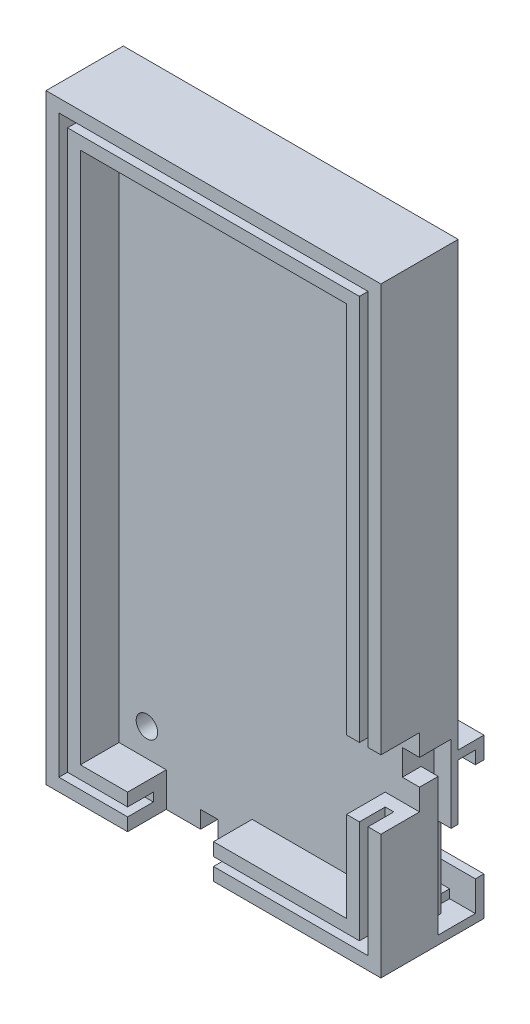
from build123d import *

# Parameters (mm, degrees)
SKETCH1_W           = 39
SKETCH1_H           = 70
BOSS_EXTRUDE1_DEPTH = 4.5
SKETCH2_W           = 39
SKETCH2_H           = 70
SKETCH2_W_2         = 31
SKETCH2_H_2         = 62
BOSS_EXTRUDE2_DEPTH = 4.5
SKETCH3_W           = 10
SKETCH3_H           = 4.5
CUT_EXTRUDE1_DEPTH  = 4
SKETCH4_W           = 4.5
SKETCH4_H           = 8
CUT_EXTRUDE2_DEPTH  = 4
SKETCH5_R           = 1.25
CUT_EXTRUDE3_DEPTH  = 4
BOSS_EXTRUDE3_DEPTH = 3
SKETCH8_W           = 1
SKETCH8_H           = 1
BOSS_EXTRUDE4_DEPTH = 28
SKETCH9_W           = 1
SKETCH9_H           = 16.5
BOSS_EXTRUDE5_DEPTH = 14
SKETCH10_W          = 1
SKETCH10_H          = 1.5
SKETCH10_H_2        = 3.5
BOSS_EXTRUDE6_DEPTH = 17
SKETCH11_W          = 1
SKETCH11_H          = 3
BOSS_EXTRUDE7_DEPTH = 3
CUT_EXTRUDE4_DEPTH  = 2
CUT_EXTRUDE5_DEPTH  = 2
SKETCH14_W          = 36
SKETCH14_H          = 67
SKETCH14_W_2        = 34
SKETCH14_H_2        = 65
CUT_EXTRUDE6_DEPTH  = 3


with BuildPart() as part:
    # Sketch1 → Boss-Extrude1 (new body)
    with BuildSketch(Plane.XY):
        with Locations((19.5, 35)):
            Rectangle(SKETCH1_W, SKETCH1_H)
    extrude(amount=BOSS_EXTRUDE1_DEPTH)

    # Sketch2 → Boss-Extrude2 (add)
    with BuildSketch(Plane.XY.offset(4.5)):
        with Locations((19.5, 35)):
            Rectangle(SKETCH2_W, SKETCH2_H)
        with Locations((19.5, 35)):
            Rectangle(SKETCH2_W_2, SKETCH2_H_2, mode=Mode.SUBTRACT)
    extrude(amount=BOSS_EXTRUDE2_DEPTH)

    # Sketch3 → Cut-Extrude1 (cut)
    with BuildSketch(Plane(origin=(0, 4, 0), x_dir=(1, 0, 0), z_dir=(0, 1, 0))):
        with Locations((14.5, -6.75)):
            Rectangle(SKETCH3_W, SKETCH3_H)
    extrude(amount=-CUT_EXTRUDE1_DEPTH, mode=Mode.SUBTRACT)

    # Sketch4 → Cut-Extrude2 (cut)
    with BuildSketch(Plane.ZY.offset(-35)):
        with Locations((6.75, 18.5)):
            Rectangle(SKETCH4_W, SKETCH4_H)
    extrude(amount=-CUT_EXTRUDE2_DEPTH, mode=Mode.SUBTRACT)

    # Sketch5 → Cut-Extrude3 (cut)
    with BuildSketch(Plane.XY.offset(4.5)):
        with Locations((7.25, 7.25)):
            Circle(SKETCH5_R)
        with Locations((31.75, 7.25)):
            Circle(SKETCH5_R)
        with Locations((7.25, 62.75)):
            Circle(SKETCH5_R)
    extrude(amount=-CUT_EXTRUDE3_DEPTH, mode=Mode.SUBTRACT)

    # Sketch7 → Boss-Extrude3 (add)
    with BuildSketch(Plane(origin=(0, 0, 0), x_dir=(-1, 0, 0), z_dir=(0, 0, -1))):
        Polygon((-8, 1), (-39, 1), (-39, 0), (-7, 0), (-7, 18.5), (-39, 18.5), (-39, 17.5), (-8, 17.5), align=None)
    extrude(amount=BOSS_EXTRUDE3_DEPTH)

    # Sketch8 → Boss-Extrude4 (add)
    with BuildSketch(Plane(origin=(8, 0, 0), x_dir=(0, 0, -1), z_dir=(1, 0, 0))):
        with Locations((1.5, 17)):
            Rectangle(SKETCH8_W, SKETCH8_H)
        with Locations((1.5, 1.5)):
            Rectangle(SKETCH8_W, SKETCH8_H)
    extrude(amount=BOSS_EXTRUDE4_DEPTH)

    # Sketch9 → Boss-Extrude5 (add)
    with BuildSketch(Plane(origin=(8, 0, 0), x_dir=(0, 0, -1), z_dir=(1, 0, 0))):
        with Locations((2.5, 9.25)):
            Rectangle(SKETCH9_W, SKETCH9_H)
    extrude(amount=BOSS_EXTRUDE5_DEPTH)

    # Sketch10 → Boss-Extrude6 (add)
    with BuildSketch(Plane(origin=(22, 0, 0), x_dir=(0, 0, -1), z_dir=(1, 0, 0))):
        with Locations((2.5, 16.75)):
            Rectangle(SKETCH10_W, SKETCH10_H)
        with Locations((2.5, 2.75)):
            Rectangle(SKETCH10_W, SKETCH10_H_2)
    extrude(amount=BOSS_EXTRUDE6_DEPTH)

    # Sketch11 → Boss-Extrude7 (add)
    with BuildSketch(Plane(origin=(0, 0, 0), x_dir=(-1, 0, 0), z_dir=(0, 0, -1))):
        Polygon((-5, 0), (-4, 0), (-4, 21.5), (-22, 21.5), (-22, 20.5), (-5, 20.5), align=None)
        with Locations((-27.5, 20)):
            Rectangle(SKETCH11_W, SKETCH11_H)
    extrude(amount=BOSS_EXTRUDE7_DEPTH)

    # Sketch12 → Cut-Extrude4 (cut)
    with BuildSketch(Plane.XZ):
        Polygon((5, 2), (5, 0), (15.5, 0), (15.5, 4.5), (13.5, 4.5), (13.5, 2), align=None)
    extrude(amount=-CUT_EXTRUDE4_DEPTH, mode=Mode.SUBTRACT)

    # Sketch13 → Cut-Extrude5 (cut)
    with BuildSketch(Plane(origin=(39, 0, 0), x_dir=(0, 0, -1), z_dir=(1, 0, 0))):
        Polygon((-4.5, 20), (-4.5, 17), (-2.326586719, 17), (-2.326586719, 1), (0, 1), (0, 11), (-0.826586719, 11), (-0.826586719, 20), align=None)
    extrude(amount=-CUT_EXTRUDE5_DEPTH, mode=Mode.SUBTRACT)

    # Sketch14 → Cut-Extrude6 (cut)
    with BuildSketch(Plane.XY.offset(9)):
        with Locations((19.5, 35)):
            Rectangle(SKETCH14_W, SKETCH14_H)
        with Locations((19.5, 35)):
            Rectangle(SKETCH14_W_2, SKETCH14_H_2, mode=Mode.SUBTRACT)
    extrude(amount=-CUT_EXTRUDE6_DEPTH, mode=Mode.SUBTRACT)


solid = part.part
